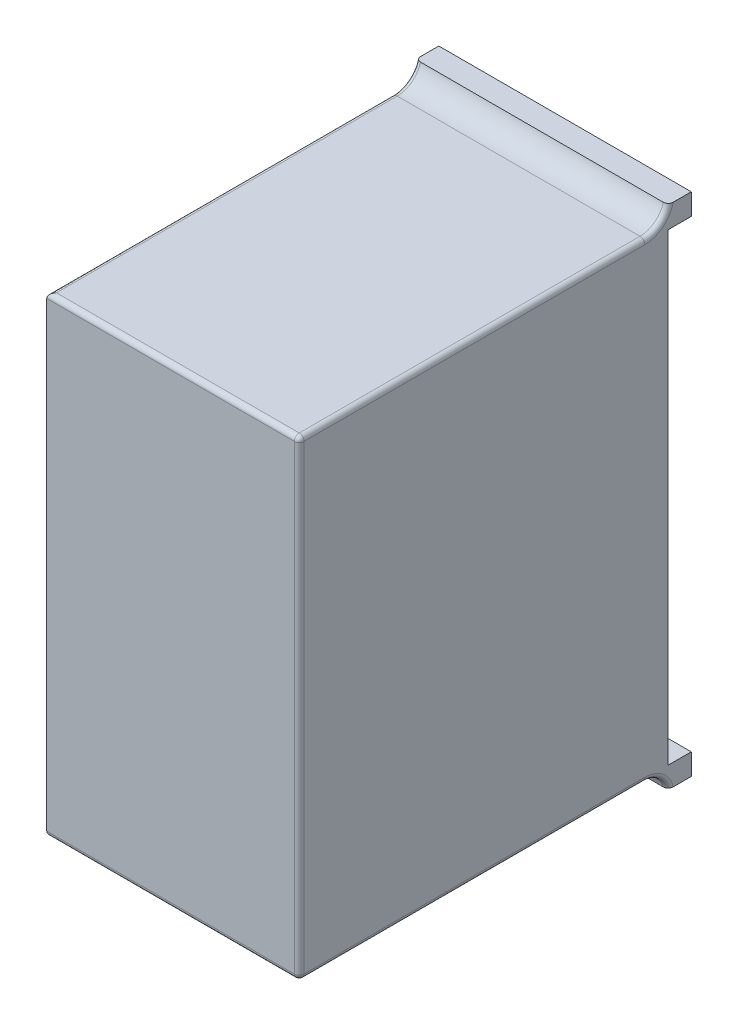
from build123d import *

# Parameters (mm, degrees)
SKETCH1_W           = 194
SKETCH1_H           = 152
BOSS_EXTRUDE1_DEPTH = 104
SHELL1_T            = -1.5
CUT_EXTRUDE1_DEPTH  = 2
SKETCH4_W           = 104
SKETCH4_H           = 8.8
BOSS_EXTRUDE2_DEPTH = 9.5
FILLET1_R           = 10
FILLET2_R           = 2


with BuildPart() as part:
    # Sketch1 → Boss-Extrude1 (new body)
    with BuildSketch(Plane.YZ):
        with Locations((97, -76)):
            Rectangle(SKETCH1_W, SKETCH1_H)
    extrude(amount=BOSS_EXTRUDE1_DEPTH)

    # Shell1
    shell1_openings = [part.faces().sort_by_distance(p)[0] for p in [
        (52, 97, -152),
    ]]
    offset(amount=SHELL1_T, openings=shell1_openings, kind=Kind.INTERSECTION)

    # Sketch2 → Cut-Extrude1 (cut)
    with BuildSketch(Plane(origin=(0, 0, 0), x_dir=(0, -1, 0), z_dir=(-1, 0, 0))):
        Polygon((-192.5, -1.5), (-192.5, -150.5), (-192.5, -152), (-1.5, -152), (-1.5, -150.5), (-1.5, -1.5), align=None)
    extrude(amount=-CUT_EXTRUDE1_DEPTH, mode=Mode.SUBTRACT)

    # Sketch4 → Boss-Extrude2 (add)
    with BuildSketch(Plane(origin=(0, 0, -152), x_dir=(1, 0, 0), z_dir=(0, 0, -1))):
        with Locations((52, 2.9)):
            Rectangle(SKETCH4_W, SKETCH4_H)
        with Locations((52, -196.9)):
            Rectangle(SKETCH4_W, SKETCH4_H)
    extrude(amount=BOSS_EXTRUDE2_DEPTH)

    # Fillet1
    # the kernel refuses this fillet: 10 mm, written as the material it adds along each edge
    with BuildSketch(Plane(origin=(0, 0, -152), x_dir=(0, -1, 0), z_dir=(1, 0, 0))) as fillet1_piece_1:
        with BuildLine():
            CenterArc((10, -9.628603222), FILLET1_R, 105.664266851, 74.335733149)
            Line((0, -9.628603222), (-0.2, -9.628603222))
            Line((-0.2, -9.628603222), (-0.2, 0))
            Line((-0.2, 0), (0, 0.2))
            ThreePointArc((0, 0.2), (3.65, 0.2), (7.246, 0.192572064))
            Line((7.246, 0.192572064), (7.3, 0))
        make_face()
    extrude(amount=104)
    with BuildSketch(Plane(origin=(0, 194, -152), x_dir=(0, 1, 0), z_dir=(1, 0, 0))) as fillet1_piece_2:
        with BuildLine():
            CenterArc((10, 9.628603222), FILLET1_R, 180, 74.335733149)
            Line((0, 9.628603222), (-0.2, 9.628603222))
            Line((-0.2, 9.628603222), (-0.2, 0))
            Line((-0.2, 0), (0, -0.2))
            ThreePointArc((0, -0.2), (3.65, -0.2), (7.246, -0.192572064))
            Line((7.246, -0.192572064), (7.3, 0))
        make_face()
    extrude(amount=104)

    # Fillet2
    # the kernel refuses this fillet: 2 mm, written as the material it takes off along each edge
    with BuildSketch(Plane(origin=(102, 2, -2), x_dir=(1, 0, 0), z_dir=(0, -1, 0))) as fillet2_piece_1_section:
        Polygon((0, 0), (FILLET2_R, 0), (FILLET2_R, FILLET2_R), (0, FILLET2_R), align=None)
    fillet2_piece_1 = extrude(amount=FILLET2_R, mode=Mode.PRIVATE)
    fillet2_piece_1 = fillet2_piece_1 - Plane(origin=(102, 2, -2), x_dir=(-0.7071067811865475, 0, -0.7071067811865475), z_dir=(0, -1, 0)) * Sphere(FILLET2_R, mode=Mode.PRIVATE)
    add(fillet2_piece_1, mode=Mode.SUBTRACT)
    with BuildSketch(Plane(origin=(102, 192, -2), x_dir=(1, 0, 0), z_dir=(0, 1, 0))) as fillet2_piece_2_section:
        Polygon((0, 0), (FILLET2_R, 0), (FILLET2_R, -FILLET2_R), (0, -FILLET2_R), align=None)
    fillet2_piece_2 = extrude(amount=FILLET2_R, mode=Mode.PRIVATE)
    fillet2_piece_2 = fillet2_piece_2 - Plane(origin=(102, 192, -2), x_dir=(-0.7071067811865475, 0, -0.7071067811865475), z_dir=(0, 1, 0)) * Sphere(FILLET2_R, mode=Mode.PRIVATE)
    add(fillet2_piece_2, mode=Mode.SUBTRACT)
    with BuildSketch(Plane(origin=(104, 2, 0), x_dir=(0, 0, -1), z_dir=(0, 1, 0))) as fillet2_piece_3:
        with BuildLine():
            CenterArc((FILLET2_R, FILLET2_R), FILLET2_R, 180, 90)
            Line((0, FILLET2_R), (0, 0))
            Line((0, 0), (FILLET2_R, 0))
        make_face()
    extrude(amount=190, mode=Mode.SUBTRACT)
    with BuildSketch(Plane(origin=(104, 0, -142.371396778), x_dir=(0, 1, 0), z_dir=(0, 0, 1))) as fillet2_piece_4:
        with BuildLine():
            CenterArc((FILLET2_R, FILLET2_R), FILLET2_R, 180, 90)
            Line((0, FILLET2_R), (0, 0))
            Line((0, 0), (FILLET2_R, 0))
        make_face()
    extrude(amount=140.371396778, mode=Mode.SUBTRACT)
    with BuildSketch(Plane(origin=(0, 0, -142.371396778), x_dir=(0, 1, 0), z_dir=(0, 0, 1))) as fillet2_piece_5:
        with BuildLine():
            CenterArc((FILLET2_R, -FILLET2_R), FILLET2_R, 90, 90)
            Line((0, -FILLET2_R), (0, 0))
            Line((0, 0), (FILLET2_R, 0))
        make_face()
    extrude(amount=147.371396778, mode=Mode.SUBTRACT)
    with BuildSketch(Plane(origin=(-5, 0, 0), x_dir=(0, 1, 0), z_dir=(1, 0, 0)), Plane(origin=(-5, 194, 0), x_dir=(0, 0, -1), z_dir=(1, 0, 0))) as fillet2_piece_6:
        with BuildLine():
            CenterArc((FILLET2_R, -FILLET2_R), FILLET2_R, 90, 90)
            Line((0, -FILLET2_R), (0, 0))
            Line((0, 0), (FILLET2_R, 0))
        make_face()
    extrude(amount=107, mode=Mode.SUBTRACT)
    with BuildSketch(Plane(origin=(0, 194, 5), x_dir=(1, 0, 0), z_dir=(0, 0, -1))) as fillet2_piece_7:
        with BuildLine():
            CenterArc((FILLET2_R, FILLET2_R), FILLET2_R, 180, 90)
            Line((0, FILLET2_R), (0, 0))
            Line((0, 0), (FILLET2_R, 0))
        make_face()
    extrude(amount=147.371396778, mode=Mode.SUBTRACT)
    with BuildSketch(Plane(origin=(104, 194, -2), x_dir=(-1, 0, 0), z_dir=(0, 0, -1))) as fillet2_piece_8:
        with BuildLine():
            CenterArc((FILLET2_R, -FILLET2_R), FILLET2_R, 90, 90)
            Line((0, -FILLET2_R), (0, 0))
            Line((0, 0), (FILLET2_R, 0))
        make_face()
    extrude(amount=140.371396778, mode=Mode.SUBTRACT)
    with BuildSketch(Plane(origin=(0, -10, -142.371396778), x_dir=(0, -0.2248060419259851, -0.9744035321742077), z_dir=(0, -0.9744035321742077, 0.2248060419259851))) as fillet2_piece_9:
        with BuildLine():
            CenterArc((10 + FILLET2_R, FILLET2_R), FILLET2_R, 180, 90)
            Line((10, FILLET2_R), (10, 0))
            Line((10, 0), (10 + FILLET2_R, 0))
        make_face()
    revolve(axis=Axis((0, -10, -142.371396778), (1, 0, 0)), revolution_arc=102.991472997, mode=Mode.SUBTRACT)
    with BuildSketch(Plane(origin=(104, -10, -142.371396778), x_dir=(0, -0.2248060419259851, -0.9744035321742077), z_dir=(0, -0.9744035321742077, 0.2248060419259851))) as fillet2_piece_10:
        with BuildLine():
            CenterArc((10 + FILLET2_R, -FILLET2_R), FILLET2_R, 90, 90)
            Line((10, -FILLET2_R), (10, 0))
            Line((10, 0), (10 + FILLET2_R, 0))
        make_face()
    revolve(axis=Axis((104, -10, -142.371396778), (1, 0, 0)), revolution_arc=102.991472997, mode=Mode.SUBTRACT)
    with BuildSketch(Plane(origin=(0, 204, -142.371396778), x_dir=(0, -1, 0), z_dir=(0, 0, 1))) as fillet2_piece_11:
        with BuildLine():
            CenterArc((10 + FILLET2_R, FILLET2_R), FILLET2_R, 180, 90)
            Line((10 + FILLET2_R, 0), (10, 0))
            Line((10, 0), (10, FILLET2_R))
        make_face()
    revolve(axis=Axis((0, 204, -142.371396778), (1, 0, 0)), revolution_arc=102.991472997, mode=Mode.SUBTRACT)
    with BuildSketch(Plane(origin=(104, 204, -142.371396778), x_dir=(0, -1, 0), z_dir=(0, 0, 1))) as fillet2_piece_12:
        with BuildLine():
            CenterArc((10 + FILLET2_R, -FILLET2_R), FILLET2_R, 90, 90)
            Line((10 + FILLET2_R, 0), (10, 0))
            Line((10, 0), (10, -FILLET2_R))
        make_face()
    revolve(axis=Axis((104, 204, -142.371396778), (1, 0, 0)), revolution_arc=102.991472997, mode=Mode.SUBTRACT)


solid = part.part
